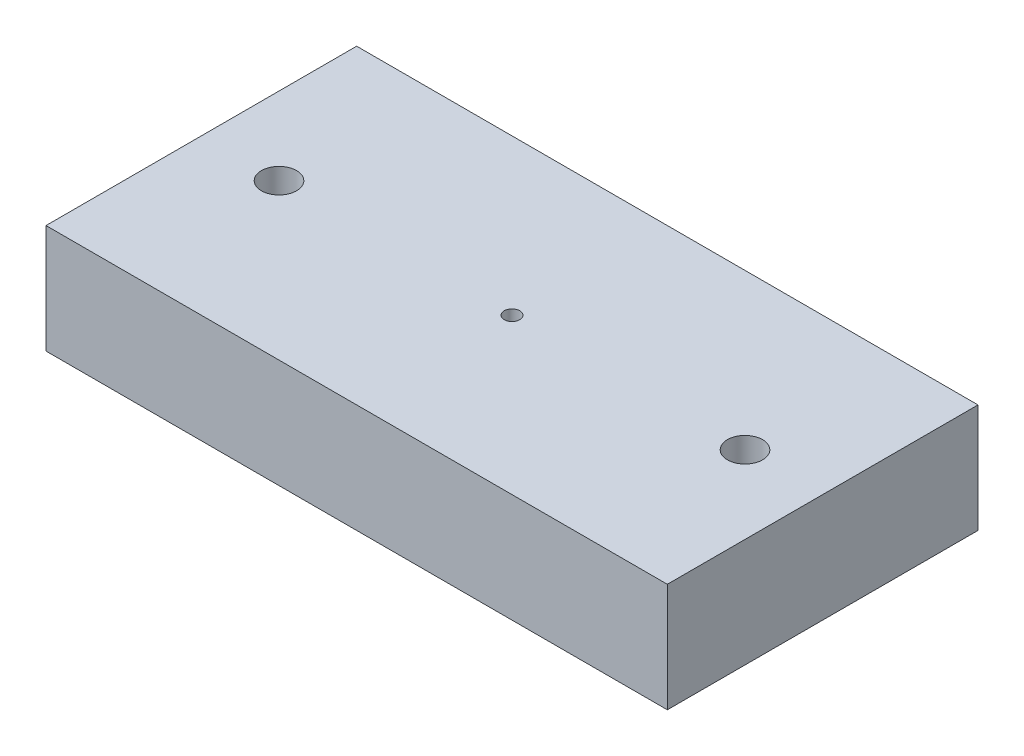
from build123d import *

# Parameters (mm, degrees)
SKETCH1_W                       = 40
SKETCH1_H                       = 20
BOSS_EXTRUDE1_DEPTH             = 7
SKETCH2_R                       = 0.5
CUT_EXTRUDE1_DEPTH              = 6.72
F_4_40_TAPPED_HOLE1_D           = 2.2606
F_4_40_TAPPED_HOLE1_CSINK_D     = 3.5306
F_4_40_TAPPED_HOLE1_CSINK_ANGLE = 90
LPATTERN1_COUNT                 = 2
LPATTERN1_PITCH                 = 30
SKETCH12_R                      = 5.55
SKETCH12_R_2                    = 3.97
CUT_EXTRUDE2_DEPTH              = 4.9
SKETCH13_W                      = 5
SKETCH13_H                      = 3.5
CUT_EXTRUDE3_DEPTH              = 0.5


with BuildPart() as part:
    # Sketch1 → Boss-Extrude1 (new body)
    with BuildSketch(Plane(origin=(0, 0, 0), x_dir=(1, 0, 0), z_dir=(0, 1, 0))):
        Rectangle(SKETCH1_W, SKETCH1_H)
    extrude(amount=BOSS_EXTRUDE1_DEPTH)

    # Sketch2 → Cut-Extrude1 (cut)
    with BuildSketch(Plane(origin=(0, 7, 0), x_dir=(1, 0, 0), z_dir=(0, 1, 0))):
        Circle(SKETCH2_R)
    extrude(amount=-CUT_EXTRUDE1_DEPTH, mode=Mode.SUBTRACT)

    # #4-40 Tapped Hole1 (through all)
    with Locations(Plane(origin=(-15, 0, 0), x_dir=(0, 0, -1), z_dir=(0, -1, 0))):
        with Locations((0, 0)):
            f_4_40_tapped_hole1 = CounterSinkHole(F_4_40_TAPPED_HOLE1_D / 2, F_4_40_TAPPED_HOLE1_CSINK_D / 2, counter_sink_angle=F_4_40_TAPPED_HOLE1_CSINK_ANGLE)

    # LPattern1: #4-40 Tapped Hole1 ×2
    with Locations(*[(i * LPATTERN1_PITCH, 0, 0) for i in range(1, LPATTERN1_COUNT)]):
        add(f_4_40_tapped_hole1, mode=Mode.SUBTRACT)

    # Sketch12 → Cut-Extrude2 (cut)
    with BuildSketch(Plane.XZ):
        Circle(SKETCH12_R)
        Circle(SKETCH12_R_2, mode=Mode.SUBTRACT)
    extrude(amount=-CUT_EXTRUDE2_DEPTH, mode=Mode.SUBTRACT)

    # Sketch13 → Cut-Extrude3 (cut)
    with BuildSketch(Plane.XZ):
        Rectangle(SKETCH13_W, SKETCH13_H)
    extrude(amount=-CUT_EXTRUDE3_DEPTH, mode=Mode.SUBTRACT)


solid = part.part
